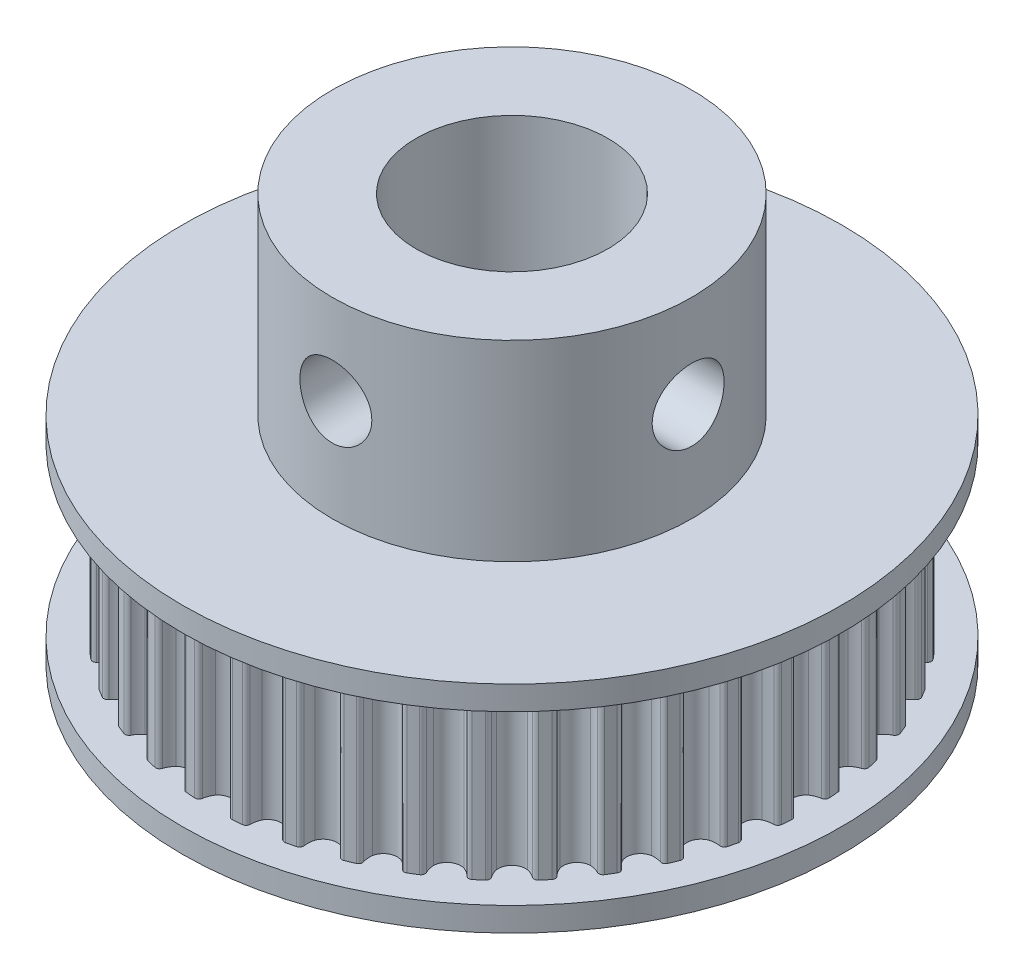
from build123d import *

# Parameters (mm, degrees)
SKETCH1_R                = 12.478406202
BOSS_EXTRUDE1_DEPTH      = 7
CUT_EXTRUDE1_START       = -10
CUT_EXTRUDE1_DEPTH       = 10
FILLET1_R                = 0.17
CIRPATTERN2_COUNT        = 40
FILLET1_OF_CIRPATTERN2_R = 0.17
SKETCH3_R                = 13.75
BOSS_EXTRUDE2_DEPTH      = 1
BOSS_EXTRUDE3_START      = 1
SKETCH4_R                = 13.75
BOSS_EXTRUDE3_DEPTH      = 1
SKETCH5_R                = 7.5
SKETCH5_R_2              = 4
BOSS_EXTRUDE4_DEPTH      = 8
SKETCH6_R                = 4
CUT_EXTRUDE2_DEPTH       = 22.427202466
CUT_EXTRUDE3_REACH       = 31.944
SKETCH7_R                = 1.5
CUT_EXTRUDE4_REACH       = 31.944
SKETCH8_R                = 1.5


with BuildPart() as part:
    # Sketch1 → Boss-Extrude1 (new body)
    with BuildSketch(Plane(origin=(0, 0, 0), x_dir=(1, 0, 0), z_dir=(0, 1, 0))):
        Circle(SKETCH1_R)
    extrude(amount=BOSS_EXTRUDE1_DEPTH)

    # Sketch2 → Cut-Extrude1 (cut)
    with BuildSketch(Plane(origin=(0, 7, 0), x_dir=(1, 0, 0), z_dir=(0, 1, 0)).offset(CUT_EXTRUDE1_START)):
        with BuildLine():
            ThreePointArc((0.453553699, 11.919974395), (0.57527485, 12.179677284), (0.619883643, 12.462999864))
            ThreePointArc((0.619883643, 12.462999864), (0, 12.478406202), (-0.619883643, 12.462999864))
            ThreePointArc((-0.619883643, 12.462999864), (-0.57527485, 12.179677284), (-0.453553699, 11.919974395))
            ThreePointArc((-0.453553699, 11.919974395), (0, 11.698406202), (0.453553699, 11.919974395))
        make_face()
    cut_extrude1 = extrude(amount=CUT_EXTRUDE1_DEPTH, mode=Mode.SUBTRACT)

    # Fillet1
    fillet1_edges = [part.edges().sort_by_distance(p)[0] for p in [
        (0.619883643, 3.5, -12.462999864),
        (-0.619883643, 3.5, -12.462999864),
    ]]
    fillet(fillet1_edges, radius=FILLET1_R)

    # CirPattern2: Cut-Extrude1 ×40 about axis
    cirpattern2_axis = Axis((0, 7, 0), (0, -1, 0))
    for i in range(1, CIRPATTERN2_COUNT):
        add(cut_extrude1.rotate(cirpattern2_axis, i * 360 / CIRPATTERN2_COUNT), mode=Mode.SUBTRACT)

    # Fillet1 of CirPattern2
    fillet1_of_cirpattern2_edges = [part.edges().sort_by_distance(p)[0] for p in [
        (2.561894563, 3.5, -12.212588488),
        (1.33739087, 3.5, -12.406530821),
        (4.440823137, 3.5, -11.661462653),
        (3.261734381, 3.5, -12.044571813),
        (6.210403906, 3.5, -10.823192905),
        (5.105763167, 3.5, -11.386035475),
        (7.827063921, 3.5, -9.718420228),
        (6.824071118, 3.5, -10.447137154),
        (9.250995645, 3.5, -8.37434779),
        (8.37434779, 3.5, -9.250995645),
        (10.447137154, 3.5, -6.824071118),
        (9.718420228, 3.5, -7.827063921),
        (11.386035475, 3.5, -5.105763167),
        (10.823192905, 3.5, -6.210403906),
        (12.044571813, 3.5, -3.261734381),
        (11.661462653, 3.5, -4.440823137),
        (12.406530821, 3.5, -1.33739087),
        (12.212588488, 3.5, -2.561894563),
        (12.462999864, 3.5, 0.619883643),
        (12.462999864, 3.5, -0.619883643),
        (12.212588488, 3.5, 2.561894563),
        (12.406530821, 3.5, 1.33739087),
        (11.661462653, 3.5, 4.440823137),
        (12.044571813, 3.5, 3.261734381),
        (10.823192905, 3.5, 6.210403906),
        (11.386035475, 3.5, 5.105763167),
        (9.718420228, 3.5, 7.827063921),
        (10.447137154, 3.5, 6.824071118),
        (8.37434779, 3.5, 9.250995645),
        (9.250995645, 3.5, 8.37434779),
        (6.824071118, 3.5, 10.447137154),
        (7.827063921, 3.5, 9.718420228),
        (5.105763167, 3.5, 11.386035475),
        (6.210403906, 3.5, 10.823192905),
        (3.261734381, 3.5, 12.044571813),
        (4.440823137, 3.5, 11.661462653),
        (1.33739087, 3.5, 12.406530821),
        (2.561894563, 3.5, 12.212588488),
        (-0.619883643, 3.5, 12.462999864),
        (0.619883643, 3.5, 12.462999864),
        (-2.561894563, 3.5, 12.212588488),
        (-1.33739087, 3.5, 12.406530821),
        (-4.440823137, 3.5, 11.661462653),
        (-3.261734381, 3.5, 12.044571813),
        (-6.210403906, 3.5, 10.823192905),
        (-5.105763167, 3.5, 11.386035475),
        (-7.827063921, 3.5, 9.718420228),
        (-6.824071118, 3.5, 10.447137154),
        (-9.250995645, 3.5, 8.37434779),
        (-8.37434779, 3.5, 9.250995645),
        (-10.447137154, 3.5, 6.824071118),
        (-9.718420228, 3.5, 7.827063921),
        (-11.386035475, 3.5, 5.105763167),
        (-10.823192905, 3.5, 6.210403906),
        (-12.044571813, 3.5, 3.261734381),
        (-11.661462653, 3.5, 4.440823137),
        (-12.406530821, 3.5, 1.33739087),
        (-12.212588488, 3.5, 2.561894563),
        (-12.462999864, 3.5, -0.619883643),
        (-12.462999864, 3.5, 0.619883643),
        (-12.212588488, 3.5, -2.561894563),
        (-12.406530821, 3.5, -1.33739087),
        (-11.661462653, 3.5, -4.440823137),
        (-12.044571813, 3.5, -3.261734381),
        (-10.823192905, 3.5, -6.210403906),
        (-11.386035475, 3.5, -5.105763167),
        (-9.718420228, 3.5, -7.827063921),
        (-10.447137154, 3.5, -6.824071118),
        (-8.37434779, 3.5, -9.250995645),
        (-9.250995645, 3.5, -8.37434779),
        (-6.824071118, 3.5, -10.447137154),
        (-7.827063921, 3.5, -9.718420228),
        (-5.105763167, 3.5, -11.386035475),
        (-6.210403906, 3.5, -10.823192905),
        (-3.261734381, 3.5, -12.044571813),
        (-4.440823137, 3.5, -11.661462653),
        (-1.33739087, 3.5, -12.406530821),
        (-2.561894563, 3.5, -12.212588488),
    ]]
    fillet(fillet1_of_cirpattern2_edges, radius=FILLET1_OF_CIRPATTERN2_R)

    # Sketch3 → Boss-Extrude2 (add)
    with BuildSketch(Plane(origin=(0, 7, 0), x_dir=(1, 0, 0), z_dir=(0, 1, 0))):
        Circle(SKETCH3_R)
    extrude(amount=BOSS_EXTRUDE2_DEPTH)

    # Sketch4 → Boss-Extrude3 (add)
    with BuildSketch(Plane.XZ.offset(BOSS_EXTRUDE3_START)):
        Circle(SKETCH4_R)
    extrude(amount=-BOSS_EXTRUDE3_DEPTH)

    # Sketch5 → Boss-Extrude4 (add)
    with BuildSketch(Plane(origin=(0, 8, 0), x_dir=(1, 0, 0), z_dir=(0, 1, 0))):
        Circle(SKETCH5_R)
        Circle(SKETCH5_R_2, mode=Mode.SUBTRACT)
    extrude(amount=BOSS_EXTRUDE4_DEPTH)

    # Sketch6 → Cut-Extrude2 (cut, through all)
    with BuildSketch(Plane(origin=(0, 8, 0), x_dir=(1, 0, 0), z_dir=(0, 1, 0))):
        Circle(SKETCH6_R)
    extrude(amount=-CUT_EXTRUDE2_DEPTH, mode=Mode.SUBTRACT)

    # Sketch7 → Cut-Extrude3 (cut, up to next)
    with BuildSketch(Plane(origin=(7.5, 0, 0), x_dir=(0, 0, -1), z_dir=(1, 0, 0)), mode=Mode.PRIVATE) as cut_extrude3_sk1:
        with Locations((0, 12.122401719)):
            Circle(SKETCH7_R)
    cut_extrude3_tool1 = extrude(cut_extrude3_sk1.sketch, amount=-CUT_EXTRUDE3_REACH, mode=Mode.PRIVATE) & part.part
    add(cut_extrude3_tool1.solids().sort_by_distance((7.5, 12.122402, 0))[0], mode=Mode.SUBTRACT)

    # Sketch8 → Cut-Extrude4 (cut, up to next)
    with BuildSketch(Plane.XY.offset(7.5), mode=Mode.PRIVATE) as cut_extrude4_sk1:
        with Locations((0, 12.239397371)):
            Circle(SKETCH8_R)
    cut_extrude4_tool1 = extrude(cut_extrude4_sk1.sketch, amount=-CUT_EXTRUDE4_REACH, mode=Mode.PRIVATE) & part.part
    add(cut_extrude4_tool1.solids().sort_by_distance((0, 12.239397, 7.5))[0], mode=Mode.SUBTRACT)


solid = part.part
